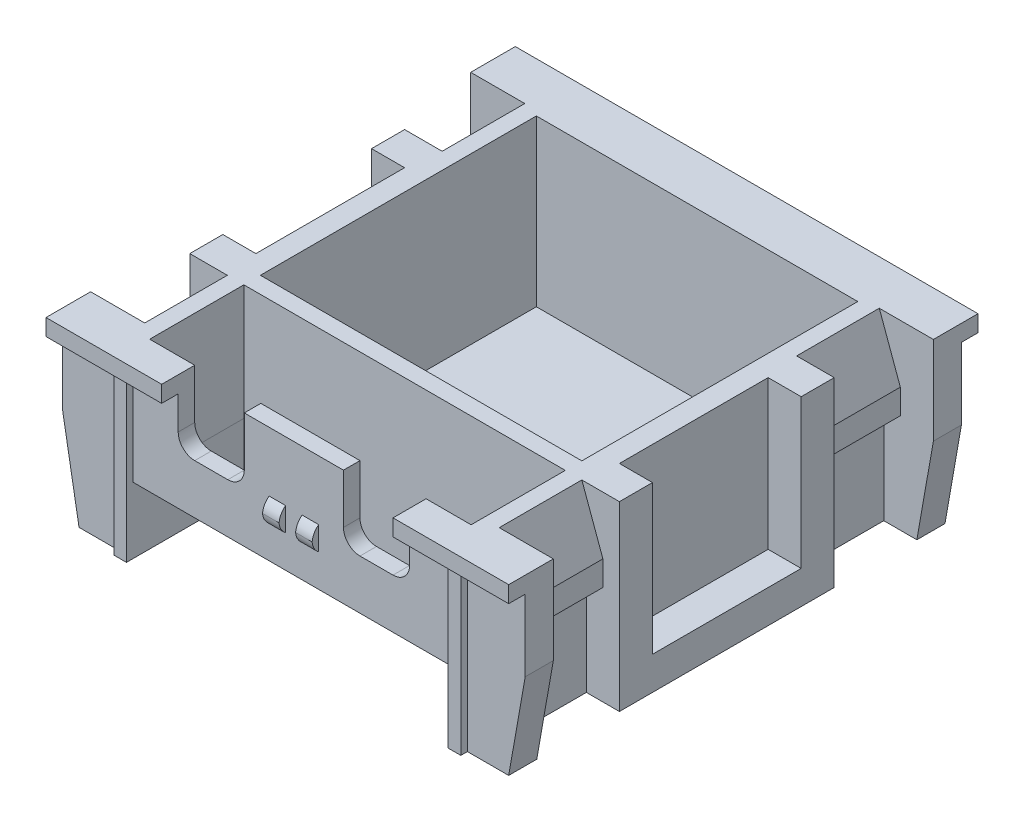
from build123d import *
from OCP.BRepFilletAPI import BRepFilletAPI_MakeChamfer

# Parameters (mm, degrees)
SKETCH1_W           = 14
SKETCH1_H           = 14.2
BOSS_EXTRUDE2_DEPTH = 5.5
SKETCH2_W           = 1
SKETCH2_H           = 2.5
CUT_EXTRUDE1_DEPTH  = 2.5
SKETCH3_W           = 1.5
SKETCH3_H           = 2.5
CUT_EXTRUDE2_DEPTH  = 3
SKETCH4_W           = 0.5
SKETCH4_H           = 6.5
CUT_EXTRUDE3_DEPTH  = 5.5
SKETCH5_W           = 1
SKETCH5_H           = 4.5
CUT_EXTRUDE4_DEPTH  = 4.5
CHAMFER2_SIZE       = 1.75
CHAMFER2_SIZE2      = 0.63694791
CHAMFER3_SIZE       = 1.75
CHAMFER3_SIZE2      = 0.63694791
SKETCH7_W           = 9.72610418
SKETCH7_H           = 2.85
CUT_EXTRUDE5_DEPTH  = 21.685502169
SKETCH8_W           = 9.72610418
SKETCH8_H           = 8.35
CUT_EXTRUDE6_DEPTH  = 5
CHAMFER4_SIZE       = 0.5
CHAMFER4_SIZE2      = 2.83564091
CHAMFER5_SIZE       = 0.5
CHAMFER5_SIZE2      = 2.83564091
SKETCH9_W           = 14
SKETCH9_H           = 0.5
CUT_EXTRUDE7_DEPTH  = 5
SKETCH11_W          = 2
SKETCH11_H          = 0.5
CUT_EXTRUDE11_DEPTH = 2
FILLET2_R           = 0.5
CUT_EXTRUDE12_START = -3.35
SKETCH12_W          = 9.73
SKETCH12_H          = 2
CUT_EXTRUDE12_DEPTH = 3.35
SKETCH13_W          = 0.5
SKETCH13_H          = 0.713041147
SKETCH13_W_2        = 0.385
SKETCH13_H_2        = 5
BOSS_EXTRUDE3_DEPTH = 0.2
FILLET4_R           = 0.5


with BuildPart() as part:
    # Sketch1 → Boss-Extrude2 (new body)
    with BuildSketch(Plane(origin=(0, 0, 0), x_dir=(1, 0, 0), z_dir=(0, 1, 0))):
        with Locations((-7, 7.1)):
            Rectangle(SKETCH1_W, SKETCH1_H)
    extrude(amount=-BOSS_EXTRUDE2_DEPTH)

    # Sketch2 → Cut-Extrude1 (cut)
    with BuildSketch(Plane(origin=(0, 0, 0), x_dir=(1, 0, 0), z_dir=(0, 1, 0))):
        with Locations((-13.5, 11.6)):
            Rectangle(SKETCH2_W, SKETCH2_H)
        with Locations((-0.5, 11.6)):
            Rectangle(SKETCH2_W, SKETCH2_H)
        with Locations((-13.5, 2.6)):
            Rectangle(SKETCH2_W, SKETCH2_H)
        with Locations((-0.5, 2.6)):
            Rectangle(SKETCH2_W, SKETCH2_H)
    extrude(amount=-CUT_EXTRUDE1_DEPTH, mode=Mode.SUBTRACT)

    # Sketch3 → Cut-Extrude2 (cut)
    with BuildSketch(Plane.XZ.offset(5.5)):
        with Locations((-13.25, -2.6)):
            Rectangle(SKETCH3_W, SKETCH3_H)
        with Locations((-0.75, -2.6)):
            Rectangle(SKETCH3_W, SKETCH3_H)
        with Locations((-0.75, -11.6)):
            Rectangle(SKETCH3_W, SKETCH3_H)
        with Locations((-13.25, -11.6)):
            Rectangle(SKETCH3_W, SKETCH3_H)
    extrude(amount=-CUT_EXTRUDE2_DEPTH, mode=Mode.SUBTRACT)

    # Sketch4 → Cut-Extrude3 (cut)
    with BuildSketch(Plane(origin=(0, 0, 0), x_dir=(1, 0, 0), z_dir=(0, 1, 0))):
        with Locations((-0.25, 7.1)):
            Rectangle(SKETCH4_W, SKETCH4_H)
        with Locations((-13.75, 7.1)):
            Rectangle(SKETCH4_W, SKETCH4_H)
    extrude(amount=-CUT_EXTRUDE3_DEPTH, mode=Mode.SUBTRACT)

    # Sketch5 → Cut-Extrude4 (cut)
    with BuildSketch(Plane(origin=(0, 0, 0), x_dir=(1, 0, 0), z_dir=(0, 1, 0))):
        with Locations((-13, 7.1)):
            Rectangle(SKETCH5_W, SKETCH5_H)
        with Locations((-1, 7.1)):
            Rectangle(SKETCH5_W, SKETCH5_H)
    extrude(amount=-CUT_EXTRUDE4_DEPTH, mode=Mode.SUBTRACT)

    # Chamfer2: one chamfer whose edges measure the first distance from different faces: ONE call of the kernel's chamfer builder (chamfer() names one face for all edges)
    chamfer2_edges_1 = [part.edges().sort_by_distance(p)[0] for p in [
        (-13, 0, -2.6),
    ]]
    chamfer2_side_1 = [part.faces().sort_by_distance(p)[0] for p in [
        (-13, -1.25, -2.6),
    ]]
    chamfer2_edges_2 = [part.edges().sort_by_distance(p)[0] for p in [
        (-13, 0, -11.6),
    ]]
    chamfer2_side_2 = [part.faces().sort_by_distance(p)[0] for p in [
        (-13, -1.25, -11.6),
    ]]
    chamfer2 = BRepFilletAPI_MakeChamfer(part.part.solid().wrapped)
    for e in chamfer2_edges_1:
        chamfer2.Add(CHAMFER2_SIZE, CHAMFER2_SIZE2, e.wrapped, chamfer2_side_1[0].wrapped)  # the first distance lies on this face
    for e in chamfer2_edges_2:
        chamfer2.Add(CHAMFER2_SIZE, CHAMFER2_SIZE2, e.wrapped, chamfer2_side_2[0].wrapped)  # the first distance lies on this face
    add(Compound.cast(chamfer2.Shape()), mode=Mode.REPLACE)

    # Chamfer3: one chamfer whose edges measure the first distance from different faces: ONE call of the kernel's chamfer builder (chamfer() names one face for all edges)
    chamfer3_edges_1 = [part.edges().sort_by_distance(p)[0] for p in [
        (-1, 0, -11.6),
    ]]
    chamfer3_side_1 = [part.faces().sort_by_distance(p)[0] for p in [
        (-1, -1.25, -11.6),
    ]]
    chamfer3_edges_2 = [part.edges().sort_by_distance(p)[0] for p in [
        (-1, 0, -2.6),
    ]]
    chamfer3_side_2 = [part.faces().sort_by_distance(p)[0] for p in [
        (-1, -1.25, -2.6),
    ]]
    chamfer3 = BRepFilletAPI_MakeChamfer(part.part.solid().wrapped)
    for e in chamfer3_edges_1:
        chamfer3.Add(CHAMFER3_SIZE, CHAMFER3_SIZE2, e.wrapped, chamfer3_side_1[0].wrapped)  # the first distance lies on this face
    for e in chamfer3_edges_2:
        chamfer3.Add(CHAMFER3_SIZE, CHAMFER3_SIZE2, e.wrapped, chamfer3_side_2[0].wrapped)  # the first distance lies on this face
    add(Compound.cast(chamfer3.Shape()), mode=Mode.REPLACE)

    # Sketch7 → Cut-Extrude5 (cut, through all)
    with BuildSketch(Plane(origin=(0, 0, 0), x_dir=(1, 0, 0), z_dir=(0, 1, 0))):
        with Locations((-7, 2.425)):
            Rectangle(SKETCH7_W, SKETCH7_H)
    extrude(amount=-CUT_EXTRUDE5_DEPTH, mode=Mode.SUBTRACT)

    # Sketch8 → Cut-Extrude6 (cut)
    with BuildSketch(Plane(origin=(0, 0, 0), x_dir=(1, 0, 0), z_dir=(0, 1, 0))):
        with Locations((-7, 8.525)):
            Rectangle(SKETCH8_W, SKETCH8_H)
    extrude(amount=-CUT_EXTRUDE6_DEPTH, mode=Mode.SUBTRACT)

    # Chamfer4
    chamfer4_edges = [part.edges().sort_by_distance(p)[0] for p in [
        (0, -5.5, -0.675),
        (0, -5.5, -13.525),
    ]]
    chamfer4_side = [part.faces().sort_by_distance(p)[0] for p in [
        (-7, -5.5, -7.966343482),
    ]]
    chamfer(chamfer4_edges, length=CHAMFER4_SIZE, length2=CHAMFER4_SIZE2, reference=chamfer4_side[0])

    # Chamfer5
    chamfer5_edges = [part.edges().sort_by_distance(p)[0] for p in [
        (-14, -5.5, -13.525),
        (-14, -5.5, -0.675),
    ]]
    chamfer5_side = [part.faces().sort_by_distance(p)[0] for p in [
        (-7.06147516, -5.5, -7.974233646),
    ]]
    chamfer(chamfer5_edges, length=CHAMFER5_SIZE, length2=CHAMFER5_SIZE2, reference=chamfer5_side[0])

    # Sketch9 → Cut-Extrude7 (cut)
    with BuildSketch(Plane.XZ.offset(5.5)):
        with Locations((-7, -0.25)):
            Rectangle(SKETCH9_W, SKETCH9_H)
        with Locations((-7, -13.95)):
            Rectangle(SKETCH9_W, SKETCH9_H)
    extrude(amount=-CUT_EXTRUDE7_DEPTH, mode=Mode.SUBTRACT)

    # Sketch11 → Cut-Extrude11 (cut)
    with BuildSketch(Plane(origin=(0, 0, 0), x_dir=(1, 0, 0), z_dir=(0, 1, 0))):
        with Locations((-9.5, 0.75)):
            Rectangle(SKETCH11_W, SKETCH11_H)
        Polygon((-10.5, 0.5), (-10.5, 0), (-3.5, 0), (-3.5, 0.5), (-5.5, 0.5), (-8.5, 0.5), align=None)
        with Locations((-4.5, 0.75)):
            Rectangle(SKETCH11_W, SKETCH11_H)
    extrude(amount=-CUT_EXTRUDE11_DEPTH, mode=Mode.SUBTRACT)

    # Fillet2
    fillet2_edges = [part.edges().sort_by_distance(p)[0] for p in [
        (-10.5, -2, -0.75),
        (-5.5, -2, -0.75),
        (-3.5, -2, -0.75),
        (-8.5, -2, -0.75),
    ]]
    fillet(fillet2_edges, radius=FILLET2_R)

    # Sketch12 → Cut-Extrude12 (cut)
    with BuildSketch(Plane.XY.offset(-0.5).offset(CUT_EXTRUDE12_START)):
        with Locations((-7, -4.5)):
            Rectangle(SKETCH12_W, SKETCH12_H)
    extrude(amount=CUT_EXTRUDE12_DEPTH, mode=Mode.SUBTRACT)

    # Sketch13 → Boss-Extrude3 (add)
    with BuildSketch(Plane.XY.offset(-0.5)):
        with Locations((-7.5, -2.158926418)):
            Rectangle(SKETCH13_W, SKETCH13_H)
        with Locations((-6.5, -2.158926418)):
            Rectangle(SKETCH13_W, SKETCH13_H)
        with Locations((-1.9425, -3)):
            Rectangle(SKETCH13_W_2, SKETCH13_H_2)
        with Locations((-12.0575, -3)):
            Rectangle(SKETCH13_W_2, SKETCH13_H_2)
    extrude(amount=BOSS_EXTRUDE3_DEPTH)

    # Fillet4
    # the kernel refuses this fillet: 0.5 mm, written as the material it takes off along each edge
    with BuildSketch(Plane(origin=(-8.75, -1.802405844, -0.3), x_dir=(0, -2.6074697955836492e-11, -1.0), z_dir=(1, 0, 0)), Plane(origin=(-7.75, -1.802405844, -0.3), x_dir=(0, -2.6074697955836492e-11, -1.0), z_dir=(1, 0, 0))) as fillet4_piece_1:
        with BuildLine():
            CenterArc((0.5, -0.4), FILLET4_R, 126.869897647, 53.130102355)
            Line((0, -0.4), (-0.01, -0.4))
            Line((-0.01, -0.4), (-0.01, 0))
            Line((-0.01, 0), (0, 0.01))
            ThreePointArc((0, 0.01), (0.1, 0.01), (0.194, 0.008))
            Line((0.194, 0.008), (0.2, 0))
        make_face()
    extrude(amount=2.5, mode=Mode.SUBTRACT)
    with BuildSketch(Plane(origin=(-5.25, -2.515446991, -0.3), x_dir=(0, 1, 0), z_dir=(-1, 0, 0)), Plane(origin=(-6.25, -2.515446991, -0.3), x_dir=(0, 1, 0), z_dir=(-1, 0, 0))) as fillet4_piece_2:
        with BuildLine():
            CenterArc((0.4, 0.5), FILLET4_R, 216.869897645, 53.130102355)
            Line((0, 0.2), (-0.008, 0.194))
            ThreePointArc((-0.008, 0.194), (-0.01, 0.1), (-0.01, 0))
            Line((-0.01, 0), (0, -0.01))
            Line((0, -0.01), (0.4, -0.01))
            Line((0.4, -0.01), (0.4, 0))
        make_face()
    extrude(amount=2.5, mode=Mode.SUBTRACT)


solid = part.part
